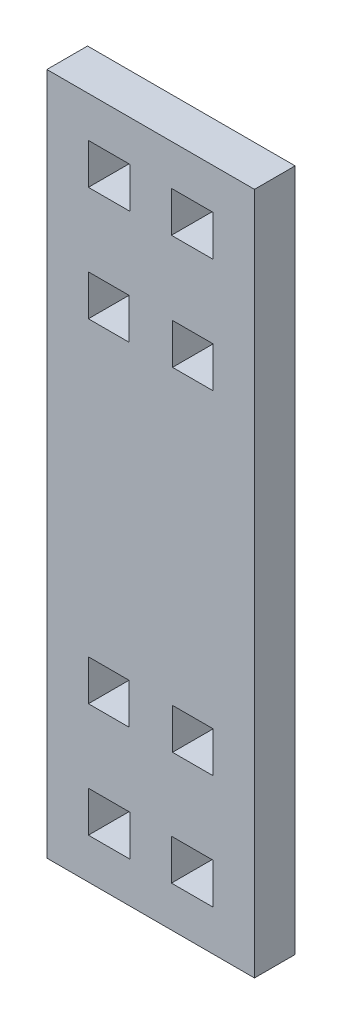
from build123d import *

# Parameters (mm, degrees)
SKETCH1_W           = 25.53
SKETCH1_H           = 84
BOSS_EXTRUDE1_DEPTH = 5
SKETCH2_W           = 5.106
SKETCH2_H           = 5
SKETCH2_W_2         = 5
CUT_EXTRUDE1_DEPTH  = 88.936232009


with BuildPart() as part:
    # Sketch1 → Boss-Extrude1 (new body)
    with BuildSketch(Plane.XY):
        with Locations((12.765, 42)):
            Rectangle(SKETCH1_W, SKETCH1_H)
    extrude(amount=BOSS_EXTRUDE1_DEPTH)

    # Sketch2 → Cut-Extrude1 (cut, through all)
    with BuildSketch(Plane.XY.offset(5)):
        with Locations((7.659, 76.5)):
            Rectangle(SKETCH2_W, SKETCH2_H)
        with Locations((17.871, 76.5)):
            Rectangle(SKETCH2_W, SKETCH2_H)
        with Locations((17.953171498, 21.5)):
            Rectangle(SKETCH2_W_2, SKETCH2_H)
        with Locations((7.606, 62.5)):
            Rectangle(SKETCH2_W_2, SKETCH2_H)
        with Locations((17.953171498, 62.5)):
            Rectangle(SKETCH2_W_2, SKETCH2_H)
        with Locations((7.606, 21.5)):
            Rectangle(SKETCH2_W_2, SKETCH2_H)
        with Locations((17.871, 7.5)):
            Rectangle(SKETCH2_W, SKETCH2_H)
        with Locations((7.659, 7.5)):
            Rectangle(SKETCH2_W, SKETCH2_H)
    extrude(amount=-CUT_EXTRUDE1_DEPTH, mode=Mode.SUBTRACT)


solid = part.part
